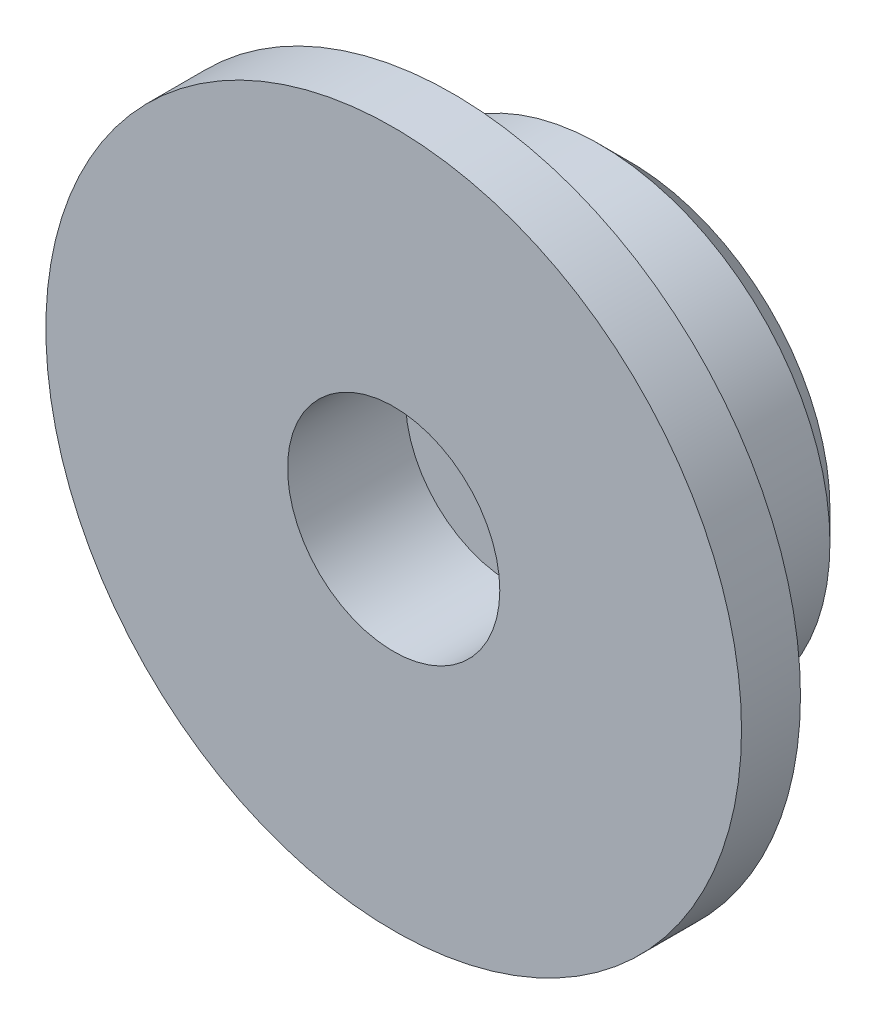
from build123d import *

# Parameters (mm, degrees)
SKETCH_1_R          = 3.9
EXTRUDE_1_DEPTH     = 3
CHAMFER_1_SIZE      = 0.5
SKETCH_4_R          = 5.9
EXTRUDE_2_DEPTH     = 1
SKETCH_5_R          = 1.8
CUT_EXTRUDE_2_DEPTH = 2


with BuildPart() as part:
    # Эскиз1 → Бобышка-Вытянуть1 (new body)
    with BuildSketch(Plane.XY):
        Circle(SKETCH_1_R)
    extrude(amount=EXTRUDE_1_DEPTH)

    # Фаска1
    chamfer_1_edges = [part.edges().sort_by_distance(p)[0] for p in [
        (-3.9, 0, 0),
    ]]
    chamfer(chamfer_1_edges, length=CHAMFER_1_SIZE)

    # Эскиз4 → Бобышка-Вытянуть2 (add)
    with BuildSketch(Plane.XY.offset(3)):
        Circle(SKETCH_4_R)
    extrude(amount=EXTRUDE_2_DEPTH)

    # Эскиз5 → Вырез-Вытянуть2 (cut)
    with BuildSketch(Plane.XY.offset(4)):
        Circle(SKETCH_5_R)
    extrude(amount=-CUT_EXTRUDE_2_DEPTH, mode=Mode.SUBTRACT)


solid = part.part
